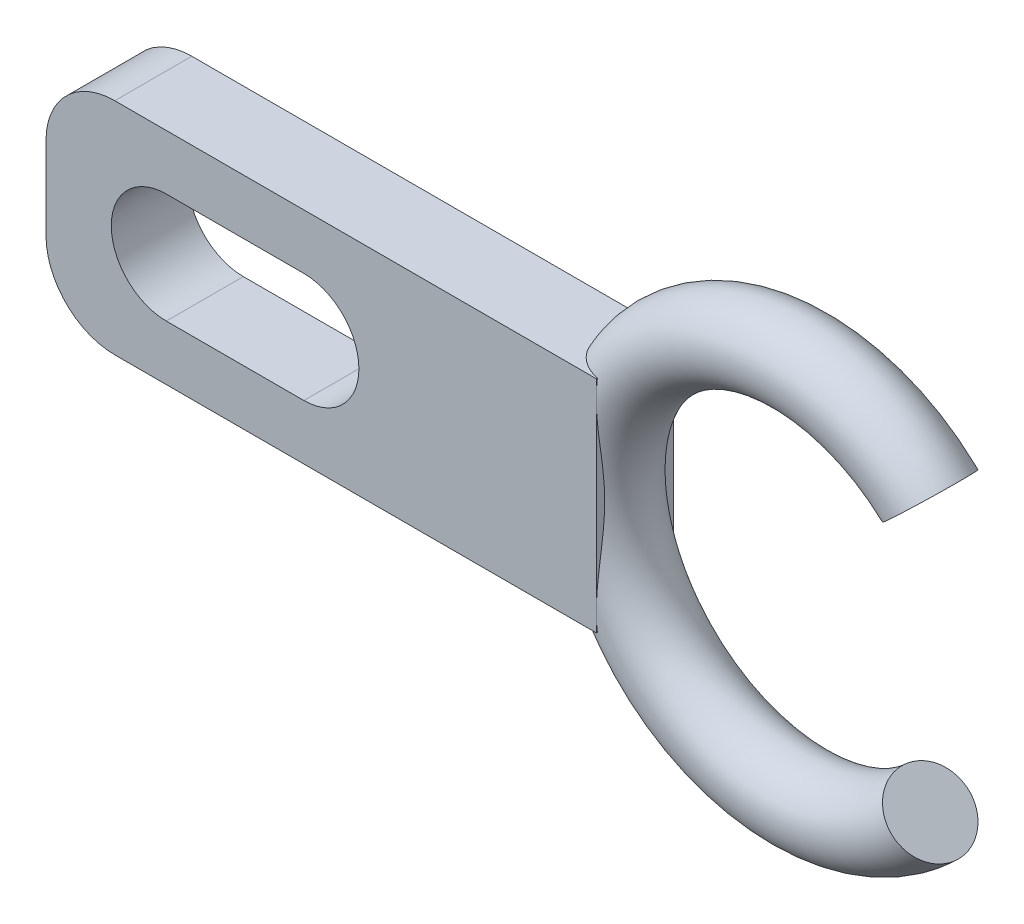
from build123d import *

# Parameters (mm, degrees)
ESBO_O2_R                  = 2.8
CORTE_EXTRUS_O1_DEPTH      = 10
CORTE_EXTRUS_O1_DEPTH_BACK = 10
RESSALTO_EXTRUS_O1_START   = -12
ESBO_O5_W                  = 5.6
ESBO_O5_H                  = 16
RESSALTO_EXTRUS_O1_DEPTH   = 40
FILETE1_R                  = 5
CORTE_EXTRUS_O2_DEPTH      = 19


with BuildPart() as part:
    # Esboço2 → Revolução1 (revolve)
    with BuildSketch(Plane(origin=(0, 0, 0), x_dir=(1, 0, 0), z_dir=(0, 1, 0))):
        with Locations((13.75, 0)):
            Circle(ESBO_O2_R)
    revolve(axis=Axis((0, 0, 0), (0, 0, -1)))

    # Esboço3 → Corte-extrusão1 (cut, two sides: drawn at the far end of the back side and taken through both)
    with BuildSketch(Plane.XY.offset(-CORTE_EXTRUS_O1_DEPTH_BACK)):
        Polygon((-1.202746457, 0), (18.041196859, 17.940967987), (18.041196859, -17.940967987), align=None)
    extrude(amount=CORTE_EXTRUS_O1_DEPTH + CORTE_EXTRUS_O1_DEPTH_BACK, mode=Mode.SUBTRACT)

    # Esboço5 → Ressalto-extrusão1 (add)
    with BuildSketch(Plane(origin=(0, 0, 0), x_dir=(0, 0, -1), z_dir=(1, 0, 0)).offset(RESSALTO_EXTRUS_O1_START)):
        Rectangle(ESBO_O5_W, ESBO_O5_H)
    extrude(amount=-RESSALTO_EXTRUS_O1_DEPTH)

    # Filete1
    filete1_edges = [part.edges().sort_by_distance(p)[0] for p in [
        (-52, 8, 0),
        (-52, -8, 0),
    ]]
    fillet(filete1_edges, radius=FILETE1_R)

    # Esboço7 → Corte-extrusão2 (cut)
    with BuildSketch(Plane(origin=(0, 0, -2.8), x_dir=(-1, 0, 0), z_dir=(0, 0, -1))):
        with BuildLine():
            Line((33.254278711, 4), (43.254278711, 4))
            ThreePointArc((43.254278711, 4), (47.254278711, 0), (43.254278711, -4))
            Line((43.254278711, -4), (33.254278711, -4))
            ThreePointArc((33.254278711, -4), (29.254278711, 0), (33.254278711, 4))
        make_face()
    extrude(amount=-CORTE_EXTRUS_O2_DEPTH, mode=Mode.SUBTRACT)


solid = part.part
